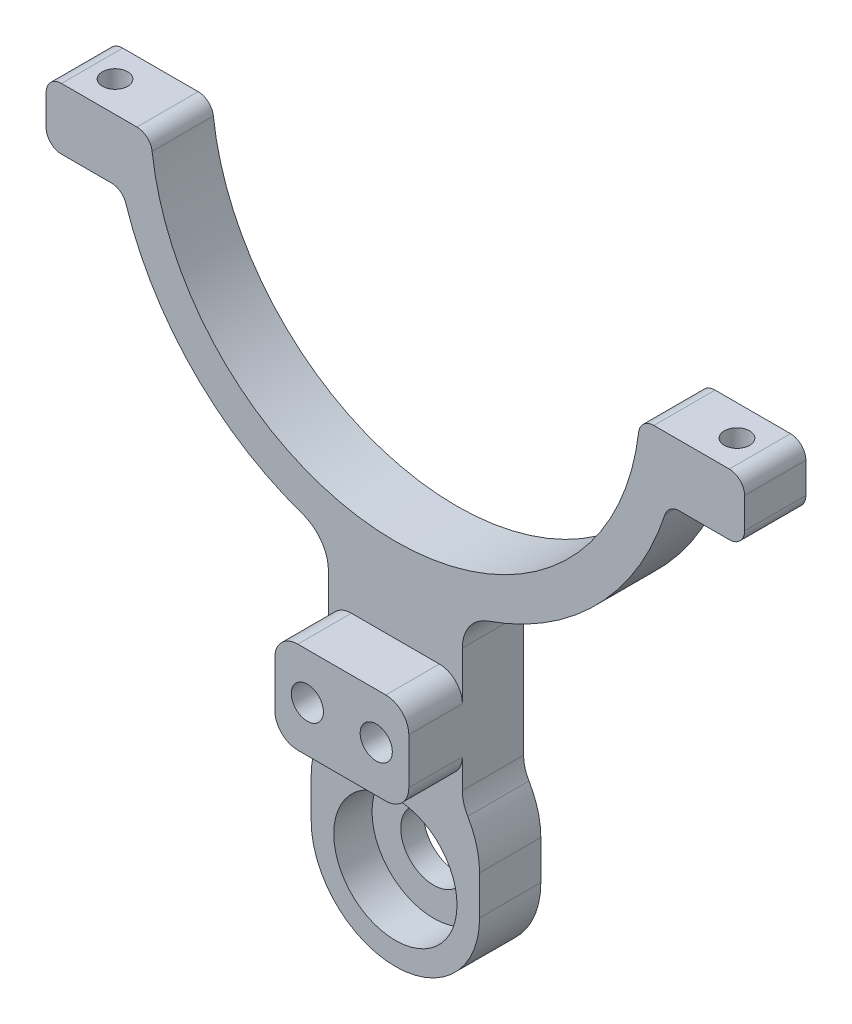
from build123d import *

# Parameters (mm, degrees)
SKETCH3_R           = 8.05
BOSS_EXTRUDE1_DEPTH = 8
SKETCH4_R           = 8.05
SKETCH4_R_2         = 4.3
BOSS_EXTRUDE2_DEPTH = 3
CHAMFER1_SIZE       = 3
FILLET1_R           = 11
SKETCH5_R           = 1.65
CUT_EXTRUDE1_DEPTH  = 85.020655349
SKETCH6_R           = 3
CUT_EXTRUDE2_DEPTH  = 3
SKETCH7_R           = 2.1
CUT_EXTRUDE3_DEPTH  = 5
SKETCH8_R           = 1.65
CUT_EXTRUDE4_DEPTH  = 93.528214752
CUT_EXTRUDE5_DEPTH  = 93.528214752
FILLET2_R           = 5
FILLET3_R           = 2
BOSS_EXTRUDE3_START = 7
SKETCH10_W          = 17.5
SKETCH10_H          = 12
SKETCH10_R          = 2.1
BOSS_EXTRUDE3_DEPTH = 7
FILLET4_R           = 3
BOSS_EXTRUDE4_START = 7
SKETCH11_R          = 2.1
SKETCH11_R_2        = 1.65
BOSS_EXTRUDE4_DEPTH = 7


with BuildPart() as part:
    # Sketch3 → Boss-Extrude1 (new body)
    with BuildSketch(Plane.XY):
        with BuildLine():
            Line((-31.937438845, -2), (-45.623026261, -2))
            Line((-45.623026261, -2), (-45.623026261, -10))
            Line((-45.623026261, -10), (-35.623026261, -10))
            ThreePointArc((-35.623026261, -10), (-26.529067588, -25.791637654), (-11, -35.327043465))
            Line((-11, -35.327043465), (-11, -80.1))
            Line((-11, -80.1), (11, -80.1))
            Line((11, -80.1), (11, -35.327043465))
            ThreePointArc((11, -35.327043465), (26.529067588, -25.791637654), (35.623026261, -10))
            Line((35.623026261, -10), (45.623026261, -10))
            Line((45.623026261, -10), (45.623026261, -2))
            Line((45.623026261, -2), (31.937438845, -2))
            ThreePointArc((31.937438845, -2), (0, -32), (-31.937438845, -2))
        make_face()
        with Locations((0, -69.1)):
            Circle(SKETCH3_R, mode=Mode.SUBTRACT)
    extrude(amount=BOSS_EXTRUDE1_DEPTH)

    # Sketch4 → Boss-Extrude2 (add)
    with BuildSketch(Plane.XY):
        with Locations(Location((0, -69.1, 0), (0, 0, 180))):
            Circle(SKETCH4_R)
        with Locations(Location((0, -69.1, 0), (0, 0, 180))):
            Circle(SKETCH4_R_2, mode=Mode.SUBTRACT)
    extrude(amount=BOSS_EXTRUDE2_DEPTH)

    # Chamfer1
    chamfer1_edges = [part.edges().sort_by_distance(p)[0] for p in [
        (0, -80.1, 0),
    ]]
    chamfer(chamfer1_edges, length=CHAMFER1_SIZE)

    # Fillet1
    fillet1_edges = [part.edges().sort_by_distance(p)[0] for p in [
        (-11, -80.1, 5.5),
        (11, -80.1, 5.5),
    ]]
    fillet(fillet1_edges, radius=FILLET1_R - 0.0001)  # a hair under: the kernel refuses the full size

    # Sketch5 → Cut-Extrude1 (cut, through all)
    with BuildSketch(Plane.XZ.offset(10)):
        with Locations((40.623026261, 4)):
            Circle(SKETCH5_R)
    cut_extrude1 = extrude(amount=-CUT_EXTRUDE1_DEPTH, mode=Mode.SUBTRACT)

    # Sketch6 → Cut-Extrude2 (cut)
    with BuildSketch(Plane.XZ.offset(10)):
        with Locations((40.623026261, 4)):
            Circle(SKETCH6_R)
    cut_extrude2 = extrude(amount=-CUT_EXTRUDE2_DEPTH, mode=Mode.SUBTRACT)

    # Mirror1: Cut-Extrude1, Cut-Extrude2 across plane
    add(cut_extrude1.mirror(Plane(origin=(0, 0, 0), x_dir=(0, 0, 1), z_dir=(1, 0, 0))), mode=Mode.SUBTRACT)
    add(cut_extrude2.mirror(Plane(origin=(0, 0, 0), x_dir=(0, 0, 1), z_dir=(1, 0, 0))), mode=Mode.SUBTRACT)

    # Sketch7 → Cut-Extrude3 (cut)
    with BuildSketch(Plane.XY.offset(8)):
        with Locations((-4.5, -49)):
            Circle(SKETCH7_R)
        with Locations((4.5, -49)):
            Circle(SKETCH7_R)
    extrude(amount=-CUT_EXTRUDE3_DEPTH, mode=Mode.SUBTRACT)

    # Sketch8 → Cut-Extrude4 (cut, through all)
    with BuildSketch(Plane.XY.offset(8)):
        with Locations((4.5, -49)):
            Circle(SKETCH8_R)
        with Locations((-4.5, -49)):
            Circle(SKETCH8_R)
    extrude(amount=-CUT_EXTRUDE4_DEPTH, mode=Mode.SUBTRACT)

    # Sketch9 → Cut-Extrude5 (cut, through all)
    with BuildSketch(Plane.XY.offset(8)):
        with BuildLine():
            Line((-8.75, -35.950486784), (-8.75, -57.333854187))
            ThreePointArc((-8.75, -57.333854187), (-10.422331793, -60.48218818), (-11, -64))
            Line((-11, -64), (-11, -35.327043465))
            ThreePointArc((-11, -35.327043465), (-9.879918795, -35.656517001), (-8.75, -35.950486784))
        make_face()
        with BuildLine():
            Line((8.75, -57.333854187), (8.75, -35.950486784))
            ThreePointArc((8.75, -35.950486784), (9.879918795, -35.656517001), (11, -35.327043465))
            Line((11, -35.327043465), (11, -64))
            ThreePointArc((11, -64), (10.422331793, -60.48218818), (8.75, -57.333854187))
        make_face()
    extrude(amount=-CUT_EXTRUDE5_DEPTH, mode=Mode.SUBTRACT)

    # Fillet2
    fillet2_edges = [part.edges().sort_by_distance(p)[0] for p in [
        (-8.75, -35.950486784, 4),
        (-8.75, -57.333854187, 4),
        (8.75, -57.333854187, 4),
        (8.75, -35.950486784, 4),
    ]]
    fillet(fillet2_edges, radius=FILLET2_R)

    # Fillet3
    fillet3_edges = [part.edges().sort_by_distance(p)[0] for p in [
        (-45.623026261, -2, 4),
        (-31.937438845, -2, 4),
        (31.937438845, -2, 4),
        (45.623026261, -2, 4),
        (45.623026261, -10, 4),
        (35.623026261, -10, 4),
        (-35.623026261, -10, 4),
        (-45.623026261, -10, 4),
    ]]
    fillet(fillet3_edges, radius=FILLET3_R - 0.0001)  # a hair under: the kernel refuses the full size

    # Sketch10 → Boss-Extrude3 (add)
    with BuildSketch(Plane.XY.offset(8).offset(BOSS_EXTRUDE3_START)):
        with Locations((0, -49)):
            Rectangle(SKETCH10_W, SKETCH10_H)
        with Locations((4.5, -49)):
            Circle(SKETCH10_R, mode=Mode.SUBTRACT)
        with Locations((-4.5, -49)):
            Circle(SKETCH10_R, mode=Mode.SUBTRACT)
    extrude(amount=-BOSS_EXTRUDE3_DEPTH)

    # Fillet4
    fillet4_edges = [part.edges().sort_by_distance(p)[0] for p in [
        (-8.75, -43, 11.5),
        (-8.75, -55, 11.5),
        (8.75, -55, 11.5),
        (8.75, -43, 11.5),
    ]]
    fillet(fillet4_edges, radius=FILLET4_R)

    # Sketch11 → Boss-Extrude4 (add)
    # profile 1 of 2: a face of its own
    with BuildSketch(Plane.XY.offset(3).offset(BOSS_EXTRUDE4_START)):
        with Locations((4.5, -49)):
            Circle(SKETCH11_R)
        with Locations((4.5, -49)):
            Circle(SKETCH11_R_2, mode=Mode.SUBTRACT)
    # profile 2 of 2: a face of its own
    with BuildSketch(Plane.XY.offset(3).offset(BOSS_EXTRUDE4_START)):
        with Locations((-4.5, -49)):
            Circle(SKETCH11_R)
        with Locations((-4.5, -49)):
            Circle(SKETCH11_R_2, mode=Mode.SUBTRACT)
    extrude(amount=-BOSS_EXTRUDE4_DEPTH)


solid = part.part
